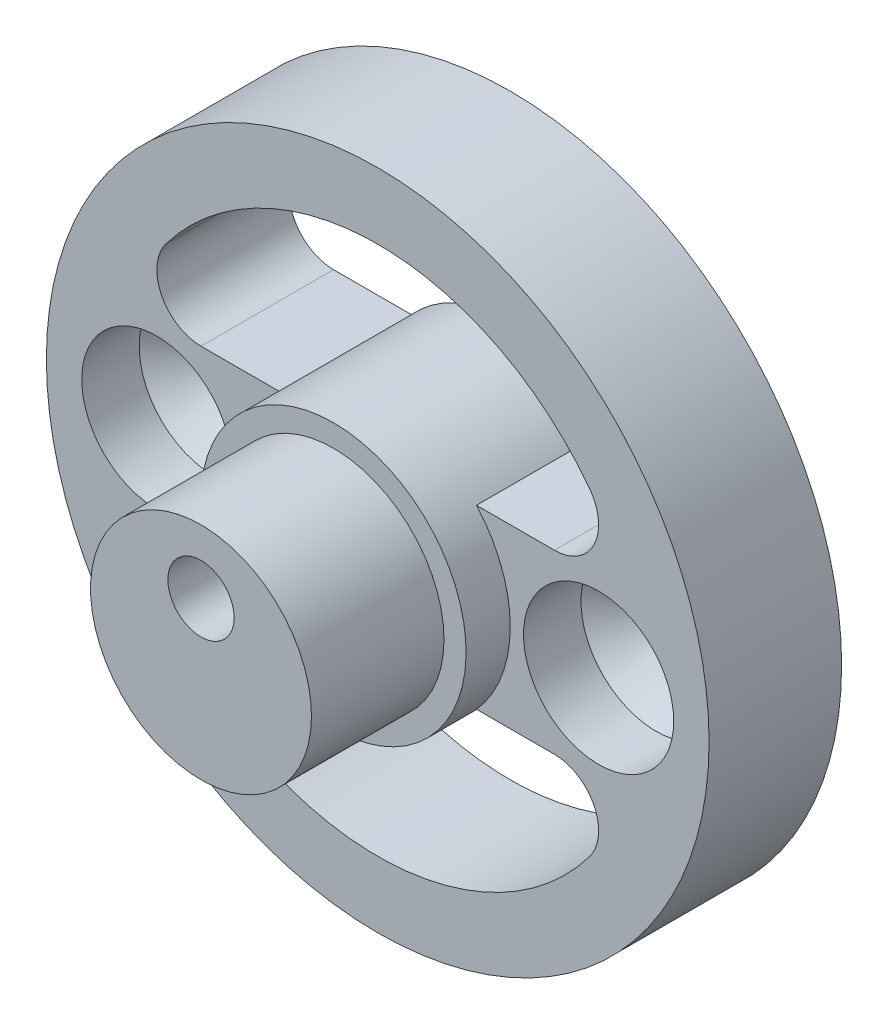
from build123d import *
from build123d.topology import SkipClean

# Parameters (mm, degrees)
SKETCH_1_R          = 5
SKETCH_1_R_2        = 0.75
EXTRUDE_1_DEPTH     = 3
SKETCH_3_R          = 6.372954201
SKETCH_3_R_2        = 2.5
CUT_EXTRUDE_1_DEPTH = 10
EXTRUDE_START       = 1
SKETCH_5_R          = 3
SKETCH_5_R_2        = 0.75
EXTRUDE_3_DEPTH     = 1
EXTRUDE_START_2     = 3
SKETCH_6_R          = 7
SKETCH_6_R_2        = 1
SKETCH_6_R_3        = 0.75
EXTRUDE_4_DEPTH     = 3
FILLET_2_R          = 1
SKETCH_7_R          = 1.5
CUT_EXTRUDE_2_DEPTH = 2
CHAMFER_1_SIZE      = 0.5
SKETCH_8_R          = 1.7
CUT_EXTRUDE_3_DEPTH = 2
CHAMFER_2_SIZE      = 0.7
SKETCH_9_R          = 7.5
SKETCH_9_R_2        = 6.7
EXTRUDE_5_DEPTH     = 3


# Some blends are built 0.0001 mm under size
with BuildPart() as part:
    # 草图1 → 凸台-拉伸1 (new body)
    with BuildSketch(Plane.XY):
        Circle(SKETCH_1_R)
        with Locations((0, 1.051)):
            Circle(SKETCH_1_R_2, mode=Mode.SUBTRACT)
    extrude(amount=EXTRUDE_1_DEPTH)

    # 草图3 → 切除-拉伸1 (cut)
    with BuildSketch(Plane.XY.offset(3)):
        Circle(SKETCH_3_R)
        Circle(SKETCH_3_R_2, mode=Mode.SUBTRACT)
    extrude(amount=-CUT_EXTRUDE_1_DEPTH, mode=Mode.SUBTRACT)

    # 草图5 → 凸台-拉伸3 (add)
    with SkipClean():  # the faces are left unmerged after this step: merging them gives an invalid solid
        with BuildSketch(Plane(origin=(0, 0, 0), x_dir=(-1, 0, 0), z_dir=(0, 0, -1)).offset(EXTRUDE_START)):
            Circle(SKETCH_5_R)
            with Locations((0, 1.051)):
                Circle(SKETCH_5_R_2, mode=Mode.SUBTRACT)
        extrude(amount=-EXTRUDE_3_DEPTH)

    # 草图6 → 凸台-拉伸4 (add)
    with SkipClean():  # the faces are left unmerged after this step: merging them gives an invalid solid
        with BuildSketch(Plane(origin=(0, 0, -1), x_dir=(-1, 0, 0), z_dir=(0, 0, -1)).offset(EXTRUDE_START_2)):
            Circle(SKETCH_6_R)
            with Locations((-5, 0)):
                Circle(SKETCH_6_R_2, mode=Mode.SUBTRACT)
            with Locations((5, 0)):
                Circle(SKETCH_6_R_2, mode=Mode.SUBTRACT)
            with Locations((0, 1.051)):
                Circle(SKETCH_6_R_3, mode=Mode.SUBTRACT)
            with BuildLine():
                Line((2.236067977, 2), (5.656854249, 2))
                ThreePointArc((5.656854249, 2), (0, 6), (-5.656854249, 2))
                Line((-5.656854249, 2), (-2.236067977, 2))
                ThreePointArc((-2.236067977, 2), (0, 3), (2.236067977, 2))
            make_face(mode=Mode.SUBTRACT)
            with BuildLine():
                Line((2.236067977, -2), (5.656854249, -2))
                ThreePointArc((5.656854249, -2), (0, -6), (-5.656854249, -2))
                Line((-5.656854249, -2), (-2.236067977, -2))
                ThreePointArc((-2.236067977, -2), (0, -3), (2.236067977, -2))
            make_face(mode=Mode.SUBTRACT)
        extrude(amount=-EXTRUDE_4_DEPTH)

    # 圆角2
    fillet_2_edges = [part.edges().sort_by_distance(p)[0] for p in [
        (-5.656854249, -2, -2.5),
        (5.656854249, -2, -2.5),
        (-5.656854249, 2, -2.5),
        (5.656854249, 2, -2.5),
    ]]
    fillet(fillet_2_edges, radius=FILLET_2_R)

    # 草图7 → 切除-拉伸2 (cut)
    with BuildSketch(Plane.XY.offset(-1)):
        with Locations((-5, 0)):
            Circle(SKETCH_7_R)
        with Locations((5, 0)):
            Circle(SKETCH_7_R)
    extrude(amount=-CUT_EXTRUDE_2_DEPTH, mode=Mode.SUBTRACT)

    # 倒角1
    chamfer_1_edges = [part.edges().sort_by_distance(p)[0] for p in [
        (-6.5, 0, -3),
        (3.5, 0, -3),
    ]]
    chamfer(chamfer_1_edges, length=CHAMFER_1_SIZE - 0.0001)  # a hair under: the kernel refuses the full size

    # 草图8 → 切除-拉伸3 (cut)
    with BuildSketch(Plane.XY.offset(-1)):
        with Locations((-5, 0)):
            Circle(SKETCH_8_R)
        with Locations((5, 0)):
            Circle(SKETCH_8_R)
    extrude(amount=-CUT_EXTRUDE_3_DEPTH, mode=Mode.SUBTRACT)

    # 倒角2
    # the kernel refuses this chamfer: 0.7 mm, written as the material it adds along each edge
    with BuildSketch(Plane(origin=(-5, 0, -3), x_dir=(1, 0, 0), z_dir=(0, -1, 0))) as chamfer_2_piece_1_section:
        Polygon((1.7, CHAMFER_2_SIZE), (1.7 - CHAMFER_2_SIZE, 0), (1.7, 0), align=None)
    chamfer_2_piece_1 = revolve(axis=Axis((-5, 0, -3), (0, 0, 1)), mode=Mode.PRIVATE)
    chamfer_2_piece_1 = chamfer_2_piece_1 - Plane(origin=(-5, 0, -2.649679333), x_dir=(-1, 0, 0), z_dir=(0, 0, -1)) * Cylinder(1, 7, mode=Mode.PRIVATE)
    add(chamfer_2_piece_1)
    with BuildSketch(Plane(origin=(5, 0, -3), x_dir=(1, 0, 0), z_dir=(0, -1, 0))) as chamfer_2_piece_2_section:
        Polygon((1.7 - CHAMFER_2_SIZE, 0), (1.7, CHAMFER_2_SIZE), (1.7, 0), align=None)
    chamfer_2_piece_2 = revolve(axis=Axis((5, 0, -3), (0, 0, 1)), mode=Mode.PRIVATE)
    chamfer_2_piece_2 = chamfer_2_piece_2 - Plane(origin=(5, 0, -2.649679333), x_dir=(-1, 0, 0), z_dir=(0, 0, -1)) * Cylinder(1, 7, mode=Mode.PRIVATE)
    add(chamfer_2_piece_2)

    # 草图9 → 凸台-拉伸5 (add)
    with BuildSketch(Plane.XY.offset(-1)):
        Circle(SKETCH_9_R)
        Circle(SKETCH_9_R_2, mode=Mode.SUBTRACT)
    extrude(amount=-EXTRUDE_5_DEPTH)


solid = part.part
